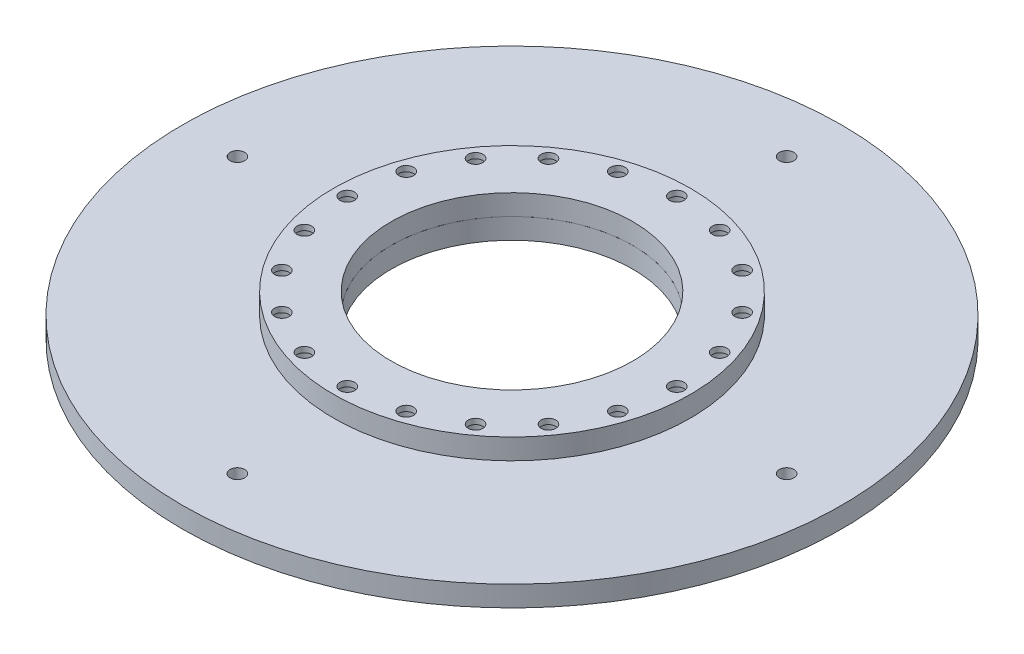
from build123d import *

# Parameters (mm, degrees)
SKETCH9_R                               = 82.55
SKETCH9_R_2                             = 55.88
REF_BACKPLATE_DEPTH                     = 9.525
REF_CBORE_BACKPLATE_D                   = 6.7564
REF_CBORE_BACKPLATE_CBORE_D             = 11.176
REF_CBORE_BACKPLATE_CBORE_DEPTH         = 6.985
REF_CBORE_BACKPLATE_PATTERN_COUNT       = 20
SKETCH1_R                               = 152.4
SKETCH1_R_2                             = 55.88
THRUSTPLATE_TC3_DEPTH                   = 9.525
SKETCH12_W                              = 3.3782
SKETCH12_H                              = 9.525
CLEARANCE_THRUSTPLATE_PATTERN_COUNT     = 4
SKETCH14_W                              = 3.175
SKETCH14_H                              = 9.525
UNDEF_CLEARANCE_BACKPLATE_PATTERN_COUNT = 10
SKETCH24_R                              = 3.175
CUT_EXTRUDE3_DEPTH                      = 3.175
CIRPATTERN4_COUNT                       = 10


with BuildPart() as part:
    # Sketch9 → REF_BackPlate (new body)
    with BuildSketch(Plane(origin=(0, 0, 0), x_dir=(1, 0, 0), z_dir=(0, 1, 0))):
        Circle(SKETCH9_R)
        Circle(SKETCH9_R_2, mode=Mode.SUBTRACT)
    extrude(amount=REF_BACKPLATE_DEPTH)

    # REF_CBORE_BackPlate (through all)
    with Locations(Plane(origin=(0, 0, 0), x_dir=(-1, 0, 0), z_dir=(0, -1, 0))):
        with Locations((0, 76.2)):
            ref_cbore_backplate = CounterBoreHole(REF_CBORE_BACKPLATE_D / 2, REF_CBORE_BACKPLATE_CBORE_D / 2, REF_CBORE_BACKPLATE_CBORE_DEPTH)

    # REF_CBORE_BackPlate_Pattern: REF_CBORE_BackPlate ×20 about axis
    ref_cbore_backplate_pattern_axis = Axis((0, 9.525, 0), (0, -1, 0))
    for i in range(1, REF_CBORE_BACKPLATE_PATTERN_COUNT):
        add(ref_cbore_backplate.rotate(ref_cbore_backplate_pattern_axis, i * 360 / REF_CBORE_BACKPLATE_PATTERN_COUNT), mode=Mode.SUBTRACT)

    # Sketch24 → Cut-Extrude3 (cut)
    with BuildSketch(Plane(origin=(0, 0, 0), x_dir=(1, 0, 0), z_dir=(0, 1, 0))):
        with Locations((10.26557861, 64.814312495)):
            Circle(SKETCH24_R)
    cut_extrude3 = extrude(amount=CUT_EXTRUDE3_DEPTH, mode=Mode.SUBTRACT)

    # CirPattern4: Cut-Extrude3 ×10 about axis
    cirpattern4_axis = Axis((0, -9.525, 0), (0, 1, 0))
    for i in range(1, CIRPATTERN4_COUNT):
        add(cut_extrude3.rotate(cirpattern4_axis, i * 360 / CIRPATTERN4_COUNT), mode=Mode.SUBTRACT)


with BuildPart() as body_2:
    # Sketch1 → ThrustPlate_TC3 (new body)
    with BuildSketch(Plane(origin=(0, 0, 0), x_dir=(1, 0, 0), z_dir=(0, 1, 0))):
        Circle(SKETCH1_R)
        Circle(SKETCH1_R_2, mode=Mode.SUBTRACT)
    extrude(amount=-THRUSTPLATE_TC3_DEPTH)

    # Sketch12 → UNDEF_Clearance_ThrustPlate (revolve, cut)
    with BuildSketch(Plane(origin=(0, 0, -127), x_dir=(0, 0, 1), z_dir=(1, 0, 0))):
        with Locations((1.6891, 4.7625)):
            Rectangle(SKETCH12_W, SKETCH12_H)
    undef_clearance_thrustplate = revolve(axis=Axis((0, 6.35, -127), (0, -1, 0)), mode=Mode.SUBTRACT)

    # Clearance_ThrustPlate_Pattern: UNDEF_Clearance_ThrustPlate ×4 about axis
    clearance_thrustplate_pattern_axis = Axis((0, -9.525, 0), (0, 1, 0))
    for i in range(1, CLEARANCE_THRUSTPLATE_PATTERN_COUNT):
        add(undef_clearance_thrustplate.rotate(clearance_thrustplate_pattern_axis, i * 360 / CLEARANCE_THRUSTPLATE_PATTERN_COUNT), mode=Mode.SUBTRACT)

    # Sketch14 → UNDEF_Clearance_BackPlate (revolve, cut)
    with BuildSketch(Plane(origin=(10.26557861, 0, -64.814312495), x_dir=(0, 0, 1), z_dir=(1, 0, 0))):
        with Locations((1.5875, 4.7625)):
            Rectangle(SKETCH14_W, SKETCH14_H)
    undef_clearance_backplate = revolve(axis=Axis((10.26557861, 6.35, -64.814312495), (0, -1, 0)), mode=Mode.SUBTRACT)

    # UNDEF_Clearance_BackPlate_Pattern: UNDEF_Clearance_BackPlate ×10 about axis
    undef_clearance_backplate_pattern_axis = Axis((0, -9.525, 0), (0, 1, 0))
    for i in range(1, UNDEF_CLEARANCE_BACKPLATE_PATTERN_COUNT):
        add(undef_clearance_backplate.rotate(undef_clearance_backplate_pattern_axis, i * 360 / UNDEF_CLEARANCE_BACKPLATE_PATTERN_COUNT), mode=Mode.SUBTRACT)


solid = Compound([part.part, body_2.part])
